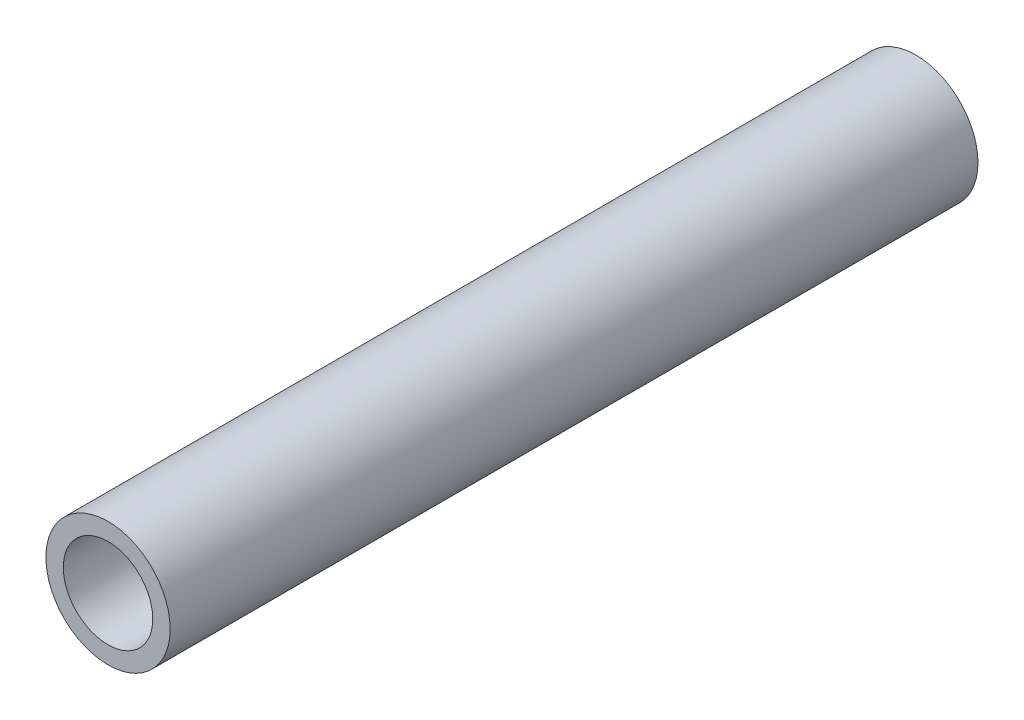
from build123d import *

# Parameters (mm, degrees)
SKETCH1_R           = 3.175
SKETCH1_R_2         = 2.286
BOSS_EXTRUDE1_DEPTH = 41.275


with BuildPart() as part:
    # Sketch1 → Boss-Extrude1 (new body)
    with BuildSketch(Plane.XY):
        Circle(SKETCH1_R)
        Circle(SKETCH1_R_2, mode=Mode.SUBTRACT)
    extrude(amount=BOSS_EXTRUDE1_DEPTH)


solid = part.part
